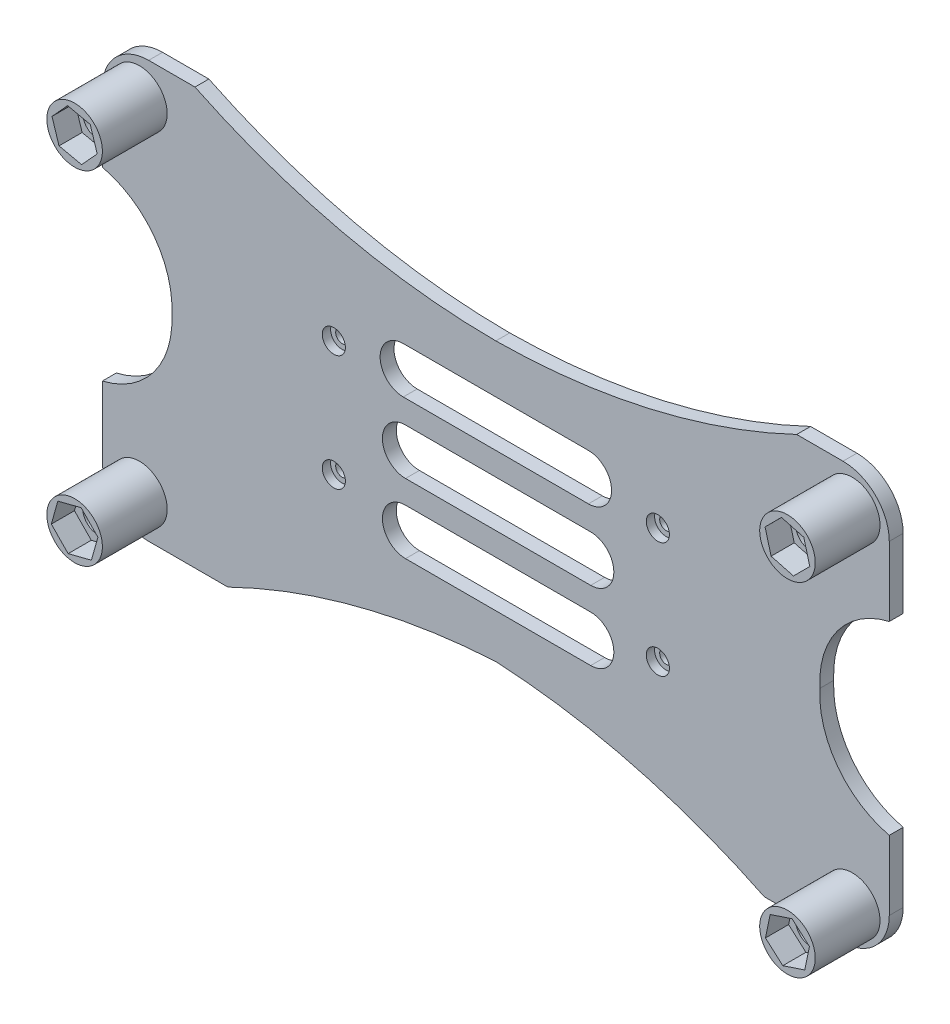
from build123d import *

# Parameters (mm, degrees)
EXTRUDE_1_DEPTH          = 3
CUT_EXTRUDE_1_DEPTH      = 42
CUT_EXTRUDE_1_DEPTH_BACK = 10
SKETCH_2_R               = 1.4
SKETCH_3_R               = 2.5
CUT_EXTRUDE_2_DEPTH      = 1.8
SKETCH_7_R               = 6
EXTRUDE_4_DEPTH          = 14
BUTTON_LEFT_NUT_DEPTH    = 5
UP_LEFT_NUT_DEPTH        = 5
UP_RIGHT_NUT_DEPTH       = 5
BUTTON_RIGHT_NUT_DEPTH   = 5
SKETCH_13_R              = 3.25
CUT_EXTRUDE_7_DEPTH      = 13
SKETCH_15_R              = 3.25
CUT_EXTRUDE_8_DEPTH      = 13
SKETCH_16_R              = 3.25
CUT_EXTRUDE_9_DEPTH      = 13
SKETCH_17_R              = 3.25
CUT_EXTRUDE_10_DEPTH     = 13


with BuildPart() as part:
    # 草图1 → 凸台-拉伸1 (new body)
    with BuildSketch(Plane.XY):
        with BuildLine():
            Line((-72.574116531, 45.487390308), (77.425883469, 45.487390308))
            ThreePointArc((77.425883469, 45.487390308), (84.496951281, 42.558458119), (87.425883469, 35.487390308))
            Line((87.425883469, 35.487390308), (87.425883469, -34.512609692))
            ThreePointArc((87.425883469, -34.512609692), (84.496951281, -41.583677504), (77.425883469, -44.512609692))
            Line((77.425883469, -44.512609692), (-72.574116531, -44.512609692))
            ThreePointArc((-72.574116531, -44.512609692), (-79.645184343, -41.583677504), (-82.574116531, -34.512609692))
            Line((-82.574116531, -34.512609692), (-82.574116531, 35.487390308))
            ThreePointArc((-82.574116531, 35.487390308), (-79.645184343, 42.558458119), (-72.574116531, 45.487390308))
        make_face()
    extrude(amount=EXTRUDE_1_DEPTH)

    # 草图2 → 切除-拉伸1 (cut, two sides: drawn at the far end of the back side and taken through both)
    with BuildSketch(Plane.XY.offset(3).offset(-CUT_EXTRUDE_1_DEPTH_BACK)):
        with Locations((-32.574116531, 12.987390308)):
            Circle(SKETCH_2_R)
        with Locations((-32.574116531, -12.012609692)):
            Circle(SKETCH_2_R)
        with Locations((37.425883469, 12.987390308)):
            Circle(SKETCH_2_R)
        with Locations((37.425883469, -12.012609692)):
            Circle(SKETCH_2_R)
        with BuildLine():
            Line((-55.457237, -44.512609692), (60.437772164, -44.512609692))
            ThreePointArc((60.437772164, -44.512609692), (32.18844776, -34.086412898), (2.425883469, -29.512609692))
            ThreePointArc((2.425883469, -29.512609692), (-27.27069034, -34.099106912), (-55.457237, -44.512609692))
        make_face()
        with BuildLine():
            Line((-62.574116531, 45.487390308), (67.425883469, 45.487390308))
            ThreePointArc((67.425883469, 45.487390308), (35.747267057, 34.428061428), (2.425883469, 30.487390308))
            ThreePointArc((2.425883469, 30.487390308), (-30.918540876, 34.328218147), (-62.574116531, 45.487390308))
        make_face()
        with BuildLine():
            Line((87.425883469, 20.487390308), (87.425883469, -19.512609692))
            ThreePointArc((87.425883469, -19.512609692), (76.286181126, -12.242386449), (72.425883469, 0.487390308))
            ThreePointArc((72.425883469, 0.487390308), (76.286181126, 13.217167065), (87.425883469, 20.487390308))
        make_face()
        with BuildLine():
            Line((-82.574116531, 20.487390308), (-82.574116531, -19.512609692))
            ThreePointArc((-82.574116531, -19.512609692), (-71.434414188, -12.242386449), (-67.574116531, 0.487390308))
            ThreePointArc((-67.574116531, 0.487390308), (-71.434414188, 13.217167065), (-82.574116531, 20.487390308))
        make_face()
        with BuildLine():
            Line((-17.574116531, 20), (22.425883469, 20))
            ThreePointArc((22.425883469, 20), (27.425883469, 15), (22.425883469, 10))
            Line((22.425883469, 10), (-17.574116531, 10))
            ThreePointArc((-17.574116531, 10), (-22.574116531, 15), (-17.574116531, 20))
        make_face()
        with BuildLine():
            Line((-17.079364826, 5), (22.920635174, 5))
            ThreePointArc((22.920635174, 5), (27.920635174, 0), (22.920635174, -5))
            Line((22.920635174, -5), (-17.079364826, -5))
            ThreePointArc((-17.079364826, -5), (-22.079364826, 0), (-17.079364826, 5))
        make_face()
        with BuildLine():
            Line((-17.079364826, -10), (22.920635174, -10))
            ThreePointArc((22.920635174, -10), (27.920635174, -15), (22.920635174, -20))
            Line((22.920635174, -20), (-17.079364826, -20))
            ThreePointArc((-17.079364826, -20), (-22.079364826, -15), (-17.079364826, -10))
        make_face()
    extrude(amount=CUT_EXTRUDE_1_DEPTH + CUT_EXTRUDE_1_DEPTH_BACK, mode=Mode.SUBTRACT)

    # 草图3 → 切除-拉伸2 (cut)
    with BuildSketch(Plane.XY.offset(3)):
        with Locations((-32.574116531, 12.987390308)):
            Circle(SKETCH_3_R)
        with Locations((37.425883469, 12.987390308)):
            Circle(SKETCH_3_R)
        with Locations((37.425883469, -12.012609692)):
            Circle(SKETCH_3_R)
        with Locations((-32.574116531, -12.012609692)):
            Circle(SKETCH_3_R)
    extrude(amount=-CUT_EXTRUDE_2_DEPTH, mode=Mode.SUBTRACT)

    # 草图7 → 凸台-拉伸4 (add)
    with BuildSketch(Plane.XY.offset(3)):
        with Locations((-74.574116531, 37.487390308)):
            Circle(SKETCH_7_R)
        with Locations((-74.574116531, -36.512609692)):
            Circle(SKETCH_7_R)
        with Locations((79.425883469, 37.487390308)):
            Circle(SKETCH_7_R)
        with Locations((79.425883469, -36.512609692)):
            Circle(SKETCH_7_R)
    extrude(amount=EXTRUDE_4_DEPTH)

    # 草图9 → button left nut (cut)
    with BuildSketch(Plane.XY.offset(17)):
        Polygon((-70.944636645, -40.226166125), (-69.543342379, -35.226166125), (-73.172822265, -31.512609692), (-78.203596417, -32.79905326), (-79.604890683, -37.79905326), (-75.975410797, -41.512609692), align=None)
    extrude(amount=-BUTTON_LEFT_NUT_DEPTH, mode=Mode.SUBTRACT)

    # 草图10 → up left nut (cut)
    with BuildSketch(Plane.XY.offset(17)):
        Polygon((-73.060671646, 32.721943363), (-69.690395974, 36.415348553), (-71.203840859, 41.180795498), (-76.087561416, 42.252837252), (-79.457837088, 38.559432062), (-77.944392202, 33.793985117), align=None)
    extrude(amount=-UP_LEFT_NUT_DEPTH, mode=Mode.SUBTRACT)

    # 草图11 → up right nut (cut)
    with BuildSketch(Plane.XY.offset(17)):
        Polygon((80.72901693, 32.660192033), (84.257926534, 36.202337852), (82.954793074, 41.029536126), (78.122750008, 42.314588582), (74.593840404, 38.772442763), (75.896973864, 33.945244489), align=None)
    extrude(amount=-UP_RIGHT_NUT_DEPTH, mode=Mode.SUBTRACT)

    # 草图12 → button right nut (cut)
    with BuildSketch(Plane.XY.offset(17)):
        Polygon((83.162930062, -39.834428887), (84.171186575, -34.937142005), (80.434139981, -31.61532281), (75.688836876, -33.190790498), (74.680580363, -38.08807738), (78.417626957, -41.409896575), align=None)
    extrude(amount=-BUTTON_RIGHT_NUT_DEPTH, mode=Mode.SUBTRACT)

    # 草图13 → 切除-拉伸7 (cut)
    with BuildSketch(Plane.XY.offset(17)):
        with Locations((-74.574116531, -36.512609692)):
            Circle(SKETCH_13_R)
    extrude(amount=-CUT_EXTRUDE_7_DEPTH, mode=Mode.SUBTRACT)

    # 草图15 → 切除-拉伸8 (cut)
    with BuildSketch(Plane.XY.offset(17)):
        with Locations((-74.574116531, 37.487390308)):
            Circle(SKETCH_15_R)
    extrude(amount=-CUT_EXTRUDE_8_DEPTH, mode=Mode.SUBTRACT)

    # 草图16 → 切除-拉伸9 (cut)
    with BuildSketch(Plane.XY.offset(17)):
        with Locations((79.425883469, 37.487390308)):
            Circle(SKETCH_16_R)
    extrude(amount=-CUT_EXTRUDE_9_DEPTH, mode=Mode.SUBTRACT)

    # 草图17 → 切除-拉伸10 (cut)
    with BuildSketch(Plane.XY.offset(17)):
        with Locations((79.425883469, -36.512609692)):
            Circle(SKETCH_17_R)
    extrude(amount=-CUT_EXTRUDE_10_DEPTH, mode=Mode.SUBTRACT)


solid = part.part
